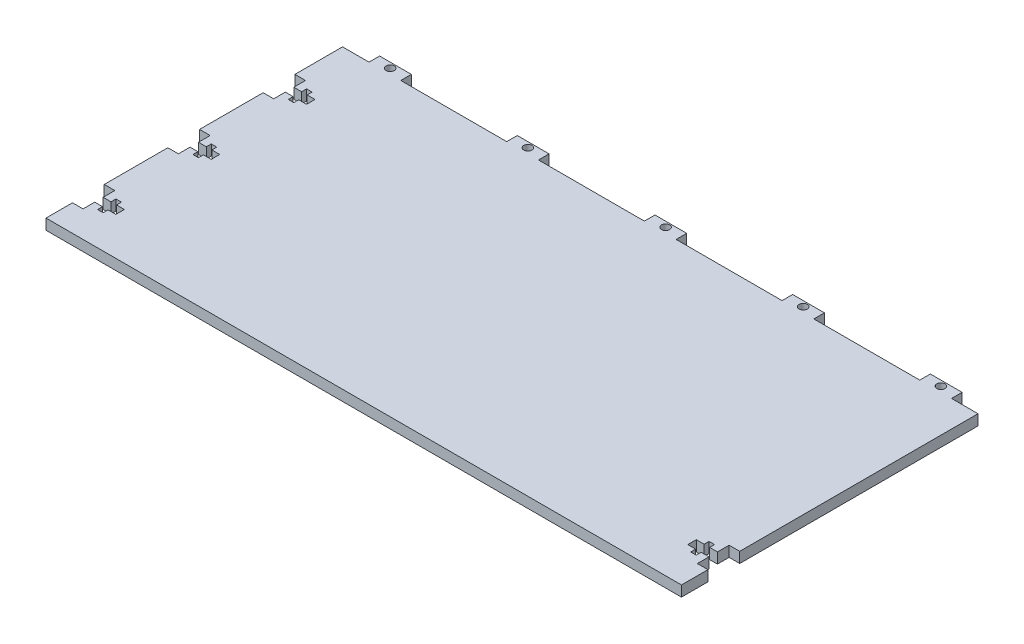
from build123d import *

# Parameters (mm, degrees)
SKETCH1_W                    = 381
SKETCH1_H                    = 177.8
BOSS_EXTRUDE1_DEPTH          = 6.35
SKETCH2_W                    = 19.05
SKETCH2_H                    = 6.35
BOSS_EXTRUDE2_DEPTH          = 6.35
F_10_0_1935_DIAMETER_HOLE1_D = 4.9149
LPATTERN1_COUNT              = 5
LPATTERN1_PITCH              = 82.55
CUT_EXTRUDE2_DEPTH           = 424.216900655
LPATTERN4_COUNT              = 3
LPATTERN4_PITCH              = 57.15


with BuildPart() as part:
    # Sketch1 → Boss-Extrude1 (new body)
    with BuildSketch(Plane(origin=(0, 0, 0), x_dir=(1, 0, 0), z_dir=(0, 1, 0))):
        with Locations((190.5, 88.9)):
            Rectangle(SKETCH1_W, SKETCH1_H)
    extrude(amount=BOSS_EXTRUDE1_DEPTH)

    # Sketch2 → Boss-Extrude2 (add)
    with BuildSketch(Plane(origin=(0, 6.35, 0), x_dir=(1, 0, 0), z_dir=(0, 1, 0))):
        with Locations((25.4, 180.975)):
            Rectangle(SKETCH2_W, SKETCH2_H)
    boss_extrude2 = extrude(amount=-BOSS_EXTRUDE2_DEPTH)

    # #10 (0.1935) Diameter Hole1 (through all)
    with Locations(Plane(origin=(0, 6.35, 0), x_dir=(1, 0, 0), z_dir=(0, 1, 0))):
        with Locations((25.4, 180.975)):
            f_10_0_1935_diameter_hole1 = Hole(F_10_0_1935_DIAMETER_HOLE1_D / 2)

    # LPattern1: Boss-Extrude2, #10 (0.1935) Diameter Hole1 ×5
    with Locations(*[(i * LPATTERN1_PITCH, 0, 0) for i in range(1, LPATTERN1_COUNT)]):
        add(boss_extrude2)
        add(f_10_0_1935_diameter_hole1, mode=Mode.SUBTRACT)

    # Sketch7 → Cut-Extrude2 (cut, through all)
    with BuildSketch(Plane(origin=(0, 6.35, 0), x_dir=(1, 0, 0), z_dir=(0, 1, 0))):
        Polygon((0, 34.925), (0, 15.875), (6.35, 15.875), (6.35, 22.86), (11.049, 22.86), (11.049, 19.9009), (14.351, 19.9009), (14.351, 22.86), (19.05, 22.86), (19.05, 27.94), (14.351, 27.94), (14.351, 30.8991), (11.049, 30.8991), (11.049, 27.94), (6.35, 27.94), (6.35, 34.925), align=None)
    cut_extrude2 = extrude(amount=-CUT_EXTRUDE2_DEPTH, mode=Mode.SUBTRACT)

    # Mirror2: Cut-Extrude2 across plane
    add(cut_extrude2.mirror(Plane.ZY.offset(-190.5)), mode=Mode.SUBTRACT)

    # LPattern4: Cut-Extrude2 ×3
    with Locations(*[(0, 0, -i * LPATTERN4_PITCH) for i in range(1, LPATTERN4_COUNT)]):
        add(cut_extrude2, mode=Mode.SUBTRACT)


solid = part.part
